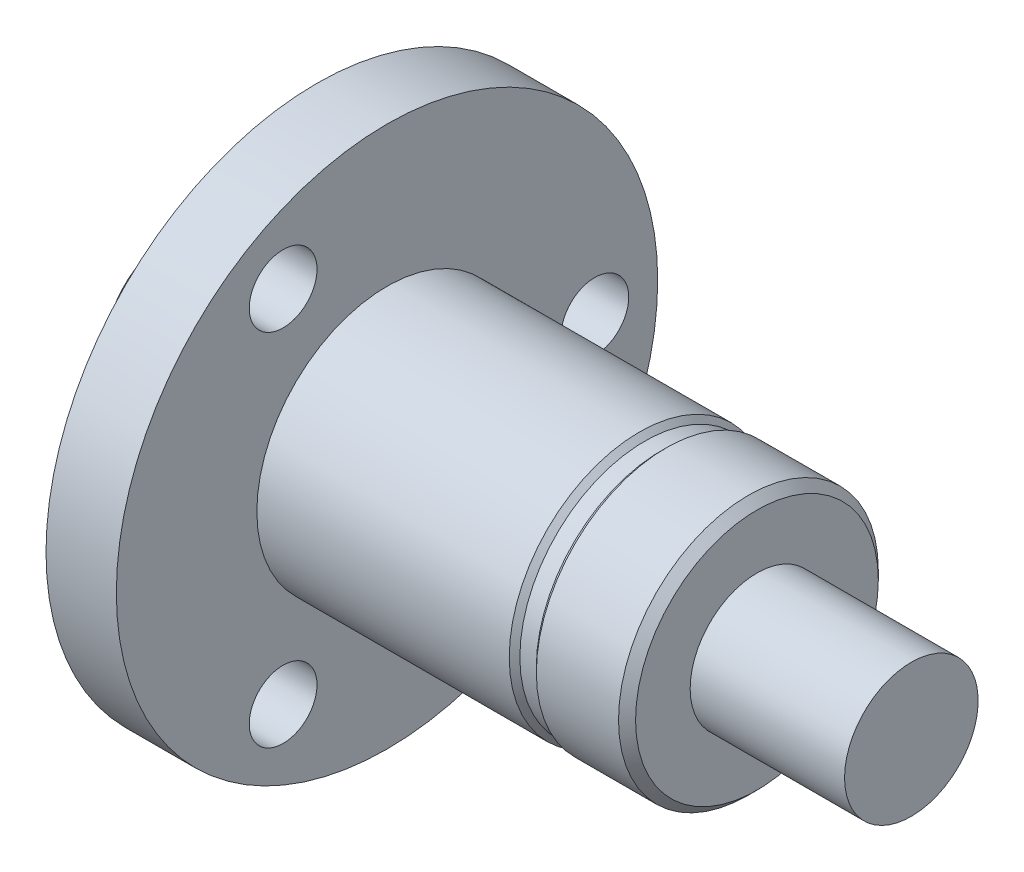
from build123d import *

# Parameters (mm, degrees)
SKETCH1_W          = 6.8
SKETCH1_H          = 3.133597909
SKETCH1_W_2        = 20.655905863
SKETCH1_W_3        = 7.244094137
SKETCH2_R          = 1.59
CUT_EXTRUDE1_DEPTH = 10
CIRPATTERN1_COUNT  = 3
CHAMFER1_SIZE      = 0.4


with BuildPart() as part:
    # Sketch1 → Revolve1 (revolve)
    with BuildSketch(Plane.XY, mode=Mode.PRIVATE) as revolve1_sk:
        with Locations((-6.7, 1.566798955)):
            Rectangle(SKETCH1_W, SKETCH1_H)
        with Locations((7.027952931, 1.566798955)):
            Rectangle(SKETCH1_W_2, SKETCH1_H)
        Polygon((17.355905863, 3.133597909), (17.355905863, 6.095), (12.7, 6.095), (12.7, 5.859469346), (12.242129105, 5.859469346), (12.242129105, 6.107765985), (0, 6.107765985), (0, 12.7), (-3.3, 12.7), (-3.3, 3.133597909), align=None)
        with Locations((20.977952931, 1.566798955)):
            Rectangle(SKETCH1_W_3, SKETCH1_H)
    revolve(revolve1_sk.sketch.rotate(Axis((-3.3, 0, 0), (1, 0, 0)), 90), axis=Axis((-3.3, 0, 0), (1, 0, 0)))

    # Sketch2 → Cut-Extrude1 (cut)
    with BuildSketch(Plane(origin=(0, 0, 0), x_dir=(0, 0, -1), z_dir=(1, 0, 0))):
        with Locations((9.75, 0)):
            Circle(SKETCH2_R)
    cut_extrude1 = extrude(amount=-CUT_EXTRUDE1_DEPTH, mode=Mode.SUBTRACT)

    # CirPattern1: Cut-Extrude1 ×3 about axis
    cirpattern1_axis = Axis((0, 0, 0), (1, 0, 0))
    for i in range(1, CIRPATTERN1_COUNT):
        add(cut_extrude1.rotate(cirpattern1_axis, i * 360 / CIRPATTERN1_COUNT), mode=Mode.SUBTRACT)

    # Chamfer1
    # the kernel refuses this chamfer: 0.4 mm, written as the material it takes off along each edge
    with BuildSketch(Plane(origin=(17.355905863, 0, 0), x_dir=(0, 0, 1), z_dir=(0, 1, 0))) as chamfer1_piece_1:
        Polygon((6.095, -CHAMFER1_SIZE), (6.095 - CHAMFER1_SIZE, 0), (6.095, 0), align=None)
    revolve(axis=Axis((17.355905863, 0, 0), (1, 0, 0)), mode=Mode.SUBTRACT)
    with BuildSketch(Plane(origin=(12.7, 0, 0), x_dir=(0, 0, 1), z_dir=(0, 1, 0))) as chamfer1_piece_2_section:
        Polygon((6.095 - CHAMFER1_SIZE, 0), (6.095, CHAMFER1_SIZE), (6.095, 0), align=None)
    chamfer1_piece_2 = revolve(axis=Axis((12.7, 0, 0), (1, 0, 0)), mode=Mode.PRIVATE)
    chamfer1_piece_2 = chamfer1_piece_2 - Plane(origin=(12.978018591, 0, 0), x_dir=(0, 0, 1), z_dir=(-1, 0, 0)) * Cylinder(5.859469346, 25, mode=Mode.PRIVATE)
    add(chamfer1_piece_2, mode=Mode.SUBTRACT)
    with BuildSketch(Plane(origin=(12.242129105, 0, 0), x_dir=(0, 0, 1), z_dir=(0, 1, 0))) as chamfer1_piece_3_section:
        Polygon((6.107765985, -CHAMFER1_SIZE), (6.107765985 - CHAMFER1_SIZE, 0), (6.107765985, 0), align=None)
    chamfer1_piece_3 = revolve(axis=Axis((12.242129105, 0, 0), (1, 0, 0)), mode=Mode.PRIVATE)
    chamfer1_piece_3 = chamfer1_piece_3 - Plane(origin=(11.970594619, 0, 0), x_dir=(0, 0, 1), z_dir=(-1, 0, 0)) * Cylinder(5.859469346, 25, mode=Mode.PRIVATE)
    add(chamfer1_piece_3, mode=Mode.SUBTRACT)


solid = part.part
